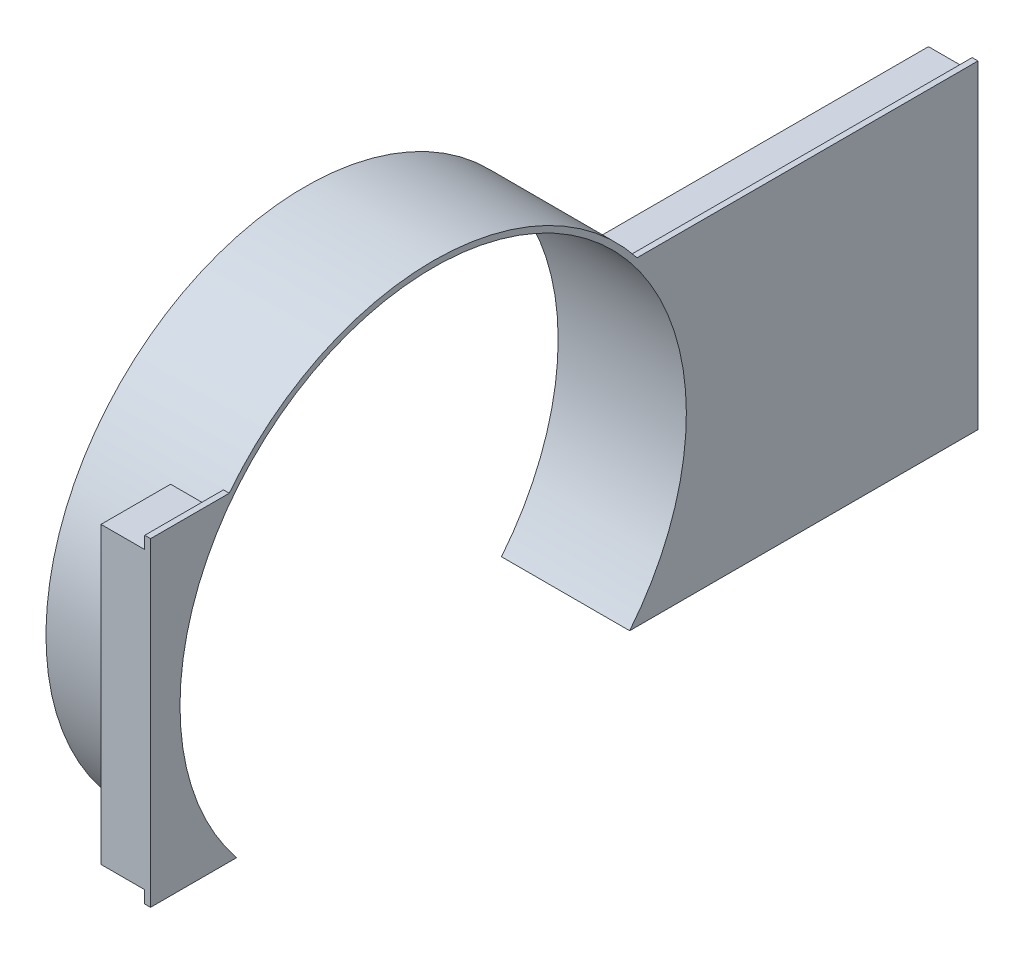
from build123d import *
from build123d.topology import SkipClean

# Parameters (mm, degrees)
BOSS_EXTRUDE1_DEPTH = 42.000000074
BOSS_EXTRUDE2_START = -2.000000064
BOSS_EXTRUDE2_DEPTH = 2.000000064
BOSS_EXTRUDE3_DEPTH = 15
BOSS_EXTRUDE4_DEPTH = 15
BOSS_EXTRUDE5_DEPTH = 15
BOSS_EXTRUDE6_DEPTH = 15
RIB1_START          = -1.27
RIB1_DEPTH          = 2.54
RIB2_START          = -1.27
RIB2_DEPTH          = 2.54
SKETCH9_W           = 2.54
SKETCH9_H           = 95.427471492
BOSS_EXTRUDE7_DEPTH = 15
SKETCH10_W          = 2.54
SKETCH10_H          = 96.020000118
BOSS_EXTRUDE8_DEPTH = 15


# Read off the part's stored shape, not the designer's step: Rib1, Rib2
with BuildPart() as part:
    # Sketch1 → Boss-Extrude1 (new body)
    with BuildSketch(Plane.ZY):
        with BuildLine():
            Line((-45.001214275, 0), (-42.443087035, 0))
            ThreePointArc((-42.443087035, 0), (25, 141.699999936), (92.443087035, 0))
            Line((92.443087035, 0), (95.001214275, 0))
            ThreePointArc((95.001214275, 0), (25, 143.7), (-45.001214275, 0))
        make_face()
    extrude(amount=BOSS_EXTRUDE1_DEPTH)

    # Sketch2 → Boss-Extrude2 (add)
    with SkipClean():  # the faces are left unmerged after this step: merging them gives an invalid solid
        with BuildSketch(Plane.ZY.offset(BOSS_EXTRUDE2_START)):
            with BuildLine():
                Line((-160, 0), (-45.001214275, 0))
                ThreePointArc((-45.001214275, 0), (-63.9, 54.8), (-45.001214275, 109.6))
                Line((-45.001214275, 109.6), (-160, 109.6))
                Line((-160, 109.6), (-162.000000064, 109.6))
                Line((-162.000000064, 109.6), (-162.000000064, 0))
                Line((-162.000000064, 0), (-160, 0))
            make_face()
            with BuildLine():
                ThreePointArc((-45.001214275, 0), (25, 143.7), (95.001214275, 0))
                Line((95.001214275, 0), (92.443087035, 0))
                ThreePointArc((92.443087035, 0), (25, 141.699999936), (-42.443087035, 0))
                Line((-42.443087035, 0), (-45.001214275, 0))
            make_face()
            with BuildLine():
                ThreePointArc((95.001214275, 109.6), (113.9, 54.8), (95.001214275, 0))
                Line((95.001214275, 0), (120, 0))
                Line((120, 0), (122.000000064, 0))
                Line((122.000000064, 0), (122.000000064, 109.6))
                Line((122.000000064, 109.6), (120, 109.6))
                Line((120, 109.6), (95.001214275, 109.6))
            make_face()
        extrude(amount=BOSS_EXTRUDE2_DEPTH)

    # Sketch3 → Boss-Extrude3 (add)
    with SkipClean():  # the faces are left unmerged after this step: merging them gives an invalid solid
        with BuildSketch(Plane.ZY):
            with BuildLine():
                Line((98.129388676, 4.249999882), (122.000000064, 4.249999882))
                Line((122.000000064, 4.249999882), (122.000000064, 6.789999882))
                Line((122.000000064, 6.789999882), (99.821453399, 6.789999882))
                ThreePointArc((99.821453399, 6.789999882), (98.986321828, 5.512738133), (98.129388676, 4.249999882))
            make_face()
        extrude(amount=BOSS_EXTRUDE3_DEPTH)

    # Sketch4 → Boss-Extrude4 (add)
    with SkipClean():  # the faces are left unmerged after this step: merging them gives an invalid solid
        with BuildSketch(Plane.ZY):
            with BuildLine():
                Line((98.129388757, 105.35), (122.000000064, 105.35))
                Line((122.000000064, 105.35), (122.000000064, 102.81))
                Line((122.000000064, 102.81), (99.821453474, 102.81))
                ThreePointArc((99.821453474, 102.81), (98.986321906, 104.087261749), (98.129388757, 105.35))
            make_face()
        extrude(amount=BOSS_EXTRUDE4_DEPTH)

    # Sketch5 → Boss-Extrude5 (add)
    with SkipClean():  # the faces are left unmerged after this step: merging them gives an invalid solid
        with BuildSketch(Plane.ZY):
            with BuildLine():
                Line((-162.000000064, 4.25), (-48.129388757, 4.25))
                ThreePointArc((-48.129388757, 4.25), (-48.986321906, 5.512738251), (-49.821453474, 6.79))
                Line((-49.821453474, 6.79), (-162.000000064, 6.79))
                Line((-162.000000064, 6.79), (-162.000000064, 4.25))
            make_face()
        extrude(amount=BOSS_EXTRUDE5_DEPTH)

    # Sketch6 → Boss-Extrude6 (add)
    with SkipClean():  # the faces are left unmerged after this step: merging them gives an invalid solid
        with BuildSketch(Plane.ZY):
            with BuildLine():
                Line((-162.000000064, 102.217471492), (-50.198360336, 102.217471492))
                ThreePointArc((-50.198360336, 102.217471492), (-49.180411643, 103.794658163), (-48.129388757, 105.35))
                Line((-48.129388757, 105.35), (-162.000000064, 105.35))
                Line((-162.000000064, 105.35), (-162.000000064, 102.217471492))
            make_face()
        extrude(amount=BOSS_EXTRUDE6_DEPTH)

    # Rib1 outline → Rib1 (add)
    with SkipClean():  # the faces are left unmerged after this step: merging them gives an invalid solid
        with BuildSketch(Plane(origin=(0, 0, -111.200000064), x_dir=(-1, 0, 0), z_dir=(0, 0, -1)).offset(RIB1_START)):
            Polygon((15, 6.79), (0, 54.503735746), (0, 6.79), align=None)
        extrude(amount=RIB1_DEPTH)

    # Rib2 outline → Rib2 (add)
    with SkipClean():  # the faces are left unmerged after this step: merging them gives an invalid solid
        with BuildSketch(Plane(origin=(0, 0, -111.200000064), x_dir=(-1, 0, 0), z_dir=(0, 0, -1)).offset(RIB2_START)):
            Polygon((0, 54.503735746), (15, 102.217471492), (0, 102.217471492), align=None)
        extrude(amount=RIB2_DEPTH)

    # Sketch9 → Boss-Extrude7 (add)
    with SkipClean():  # the faces are left unmerged after this step: merging them gives an invalid solid
        with BuildSketch(Plane.ZY):
            with Locations((-160.730000064, 54.503735746)):
                Rectangle(SKETCH9_W, SKETCH9_H)
        extrude(amount=BOSS_EXTRUDE7_DEPTH)

    # Sketch10 → Boss-Extrude8 (add)
    with SkipClean():  # the faces are left unmerged after this step: merging them gives an invalid solid
        with BuildSketch(Plane.ZY):
            with Locations((120.730000064, 54.799999941)):
                Rectangle(SKETCH10_W, SKETCH10_H)
        extrude(amount=BOSS_EXTRUDE8_DEPTH)


solid = part.part
